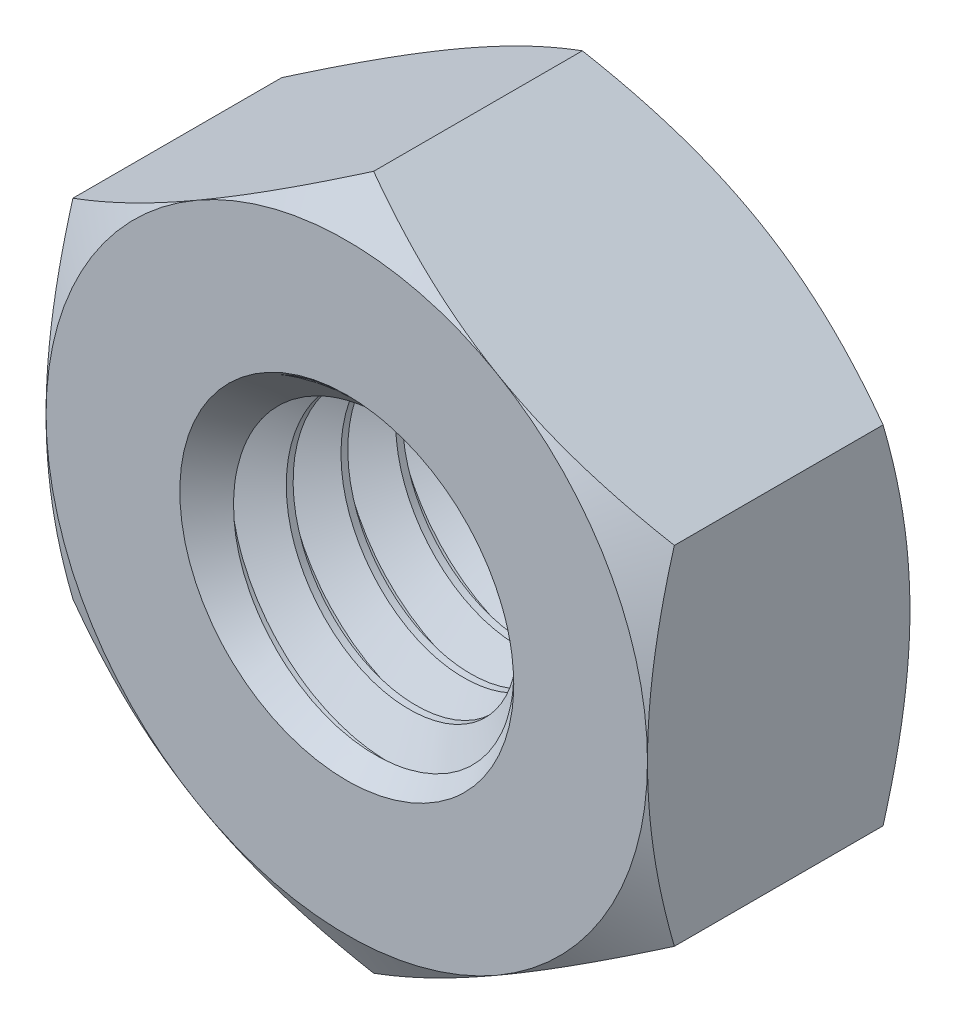
from build123d import *

# Parameters (mm, degrees)
BOSS_EXTRUDE1_DEPTH      = 1.2
BOSS_EXTRUDE1_DEPTH_BACK = 1.2
SKETCH2_R                = 1.5
SKETCH3_OUTSIDE_W        = 29.47
SKETCH3_OUTSIDE_H        = 30.32
SKETCH3_OUTSIDE_R        = 2.75
CUT_EXTRUDE1_DEPTH       = 5.837957558
CUT_EXTRUDE1_DRAFT       = -60
MIRROR1_COPY_1_SKETCH_W  = 29.47
MIRROR1_COPY_1_SKETCH_H  = 30.32
MIRROR1_COPY_1_SKETCH_R  = 2.75
MIRROR1_COPY_1_DEPTH     = 5.837957558
MIRROR1_COPY_1_DRAFT     = -60
SWEEP1_PITCH             = 0.5
SKETCH6_R                = 1.527063294
CUT_EXTRUDE2_DEPTH       = 6.113384751
SKETCH7_R                = 1.527063294
CUT_EXTRUDE3_DEPTH       = 5.837957664


with BuildPart() as part:
    # Sketch2 → Boss-Extrude1 (new, two sides: drawn at the far end of the back side and taken through both)
    with BuildSketch(Plane.XY.offset(-BOSS_EXTRUDE1_DEPTH_BACK)):
        Polygon((0, 3.175426481), (-2.75, 1.58771324), (-2.75, -1.58771324), (0, -3.175426481), (2.75, -1.58771324), (2.75, 1.58771324), align=None)
        Circle(SKETCH2_R, mode=Mode.SUBTRACT)
    extrude(amount=BOSS_EXTRUDE1_DEPTH + BOSS_EXTRUDE1_DEPTH_BACK)


with BuildPart() as cut_extrude1_tool:
    # Sketch3 outside → Cut-Extrude1 (with draft: the straight prism first)
    with BuildSketch(Plane.XY.offset(1.2)):
        Rectangle(SKETCH3_OUTSIDE_W, SKETCH3_OUTSIDE_H)
        Circle(SKETCH3_OUTSIDE_R, mode=Mode.SUBTRACT)
    extrude(amount=-CUT_EXTRUDE1_DEPTH)
    # Cut-Extrude1: the draft: its side faces are tilted about the plane it starts from
    cut_extrude1_sides = [cut_extrude1_tool.faces().sort_by_distance(p)[0] for p in [
        (0, -15.16, -1.718978779),
        (14.735, 0, -1.718978779),
        (0, 15.16, -1.718978779),
        (-14.735, 0, -1.718978779),
        (-2.75, 0, -1.718978779),
    ]]
    draft(cut_extrude1_sides, Plane.XY.offset(1.2), CUT_EXTRUDE1_DRAFT)


with BuildPart() as part_1:
    add(part.part)

    # Cut-Extrude1: cut by cut_extrude1_tool
    add(cut_extrude1_tool.part, mode=Mode.SUBTRACT)


with BuildPart() as mirror1_copy_1_tool:
    # Mirror1 copy 1 sketch → Mirror1 copy 1 (with draft: the straight prism first)
    with BuildSketch(Plane(origin=(0, 0, -1.2), x_dir=(1, 0, 0), z_dir=(0, 0, -1))):
        Rectangle(MIRROR1_COPY_1_SKETCH_W, MIRROR1_COPY_1_SKETCH_H)
        Circle(MIRROR1_COPY_1_SKETCH_R, mode=Mode.SUBTRACT)
    extrude(amount=-MIRROR1_COPY_1_DEPTH)
    # Mirror1 copy 1: the draft: its side faces are tilted about the plane it starts from
    mirror1_copy_1_sides = [mirror1_copy_1_tool.faces().sort_by_distance(p)[0] for p in [
        (0, -15.16, 1.718978779),
        (14.735, 0, 1.718978779),
        (0, 15.16, 1.718978779),
        (-14.735, 0, 1.718978779),
        (-2.75, 0, 1.718978779),
    ]]
    draft(mirror1_copy_1_sides, Plane(origin=(0, 0, -1.2), x_dir=(1, 0, 0), z_dir=(0, 0, -1)), MIRROR1_COPY_1_DRAFT)


with BuildPart() as part_2:
    add(part_1.part)

    # Mirror1 copy 1: cut by mirror1_copy_1_tool
    add(mirror1_copy_1_tool.part, mode=Mode.SUBTRACT)

    # Sweep1: the profile of Sketch4 screwed along a right-hand helix of 5.8 turns, 6 arcs to a turn; built about Z, then put on its axis
    sweep1_z = Axis((0, 0, 0), (0, 0, 1))
    sweep1_corners = [(1.527063294, 0, -0.453125), (1.175240474, 0, -0.25), (1.175240474, 0, -0.1875), (1.527063294, 0, 0.015625)]
    with BuildLine(mode=Mode.PRIVATE) as sweep1_profile:
        Line(sweep1_corners[0], sweep1_corners[1])
        Line(sweep1_corners[1], sweep1_corners[2])
        Line(sweep1_corners[2], sweep1_corners[3])
        Line(sweep1_corners[3], sweep1_corners[0])
    sweep1_cap = Face(sweep1_profile.wire())
    sweep1_turn_angles = [0, 30, 60, 90, 120, 150, 180, 210, 240, 270, 300, 330, 360]
    sweep1_turn_weights = [1, 0.8660254037844387, 1, 0.8660254037844387, 1, 0.8660254037844387, 1, 0.8660254037844387, 1, 0.8660254037844387, 1, 0.8660254037844387, 1]
    sweep1_turn_rails = [Edge.make_bspline([Vector(p[0], p[1], 0).rotate(sweep1_z, sweep1_turn_angles[k]) / sweep1_turn_weights[k] + Vector(0, 0, p[2] + SWEEP1_PITCH * sweep1_turn_angles[k] / 360) for k in range(13)], [0, 0, 0, 1, 1, 2, 2, 3, 3, 4, 4, 5, 5, 6, 6, 6], 2, sweep1_turn_weights) for p in sweep1_corners]
    sweep1_turn_sides = [Face.make_surface_from_curves(sweep1_turn_rails[p[0]], sweep1_turn_rails[p[1]]) for p in [(0, 1), (1, 2), (2, 3), (3, 0)]]
    sweep1_last_angles = [1800, 1830, 1860, 1890, 1920, 1950, 1980, 2010, 2040, 2064, 2088]
    sweep1_last_weights = [1, 0.8660254037844387, 1, 0.8660254037844387, 1, 0.8660254037844387, 1, 0.8660254037844387, 1, 0.9135454576426655, 1]
    sweep1_last_rails = [Edge.make_bspline([Vector(p[0], p[1], 0).rotate(sweep1_z, sweep1_last_angles[k]) / sweep1_last_weights[k] + Vector(0, 0, p[2] + SWEEP1_PITCH * sweep1_last_angles[k] / 360) for k in range(11)], [0, 0, 0, 1, 1, 2, 2, 3, 3, 4, 4, 5, 5, 5], 2, sweep1_last_weights) for p in sweep1_corners]
    sweep1_last_sides = [Face.make_surface_from_curves(sweep1_last_rails[p[0]], sweep1_last_rails[p[1]]) for p in [(0, 1), (1, 2), (2, 3), (3, 0)]]
    sweep1 = Plane(origin=(0, 0, 1.2), x_dir=(0, 1, 0), z_dir=(0, 0, -1)) * Solid(Shell([*[p.moved(Location((0, 0, SWEEP1_PITCH * i))) for i in range(5) for p in sweep1_turn_sides], *sweep1_last_sides, sweep1_cap, sweep1_cap.rotate(sweep1_z, 2088).moved(Location((0, 0, SWEEP1_PITCH * 2088 / 360)))]))
    add(sweep1)

    # Sketch6 → Cut-Extrude2 (cut)
    with BuildSketch(Plane.XY.offset(1.2)):
        Circle(SKETCH6_R)
    extrude(amount=CUT_EXTRUDE2_DEPTH, mode=Mode.SUBTRACT)

    # Cut-Extrude2 cone 1 section (through the dimple's axis) → Cut-Extrude2 other way (revolve, cut)
    with BuildSketch(Plane(origin=(0, 0, 1.2), x_dir=(0, -1, 0), z_dir=(1, 0, 0))):
        Polygon((0, 0), (1.527063294, 0), (0, 1.527063294), align=None)
    revolve(axis=Axis((0, 0, 1.2), (0, 0, -1)), mode=Mode.SUBTRACT)

    # Sketch7 → Cut-Extrude3 (cut)
    with BuildSketch(Plane(origin=(0, 0, -1.2), x_dir=(-1, 0, 0), z_dir=(0, 0, -1))):
        Circle(SKETCH7_R)
    extrude(amount=CUT_EXTRUDE3_DEPTH, mode=Mode.SUBTRACT)

    # Cut-Extrude3 cone 1 section (through the dimple's axis) → Cut-Extrude3 other way (revolve, cut)
    with BuildSketch(Plane(origin=(0, 0, -1.2), x_dir=(0, 1, 0), z_dir=(1, 0, 0))):
        Polygon((0, 0), (1.527063294, 0), (0, 1.527063294), align=None)
    revolve(axis=Axis((0, 0, -1.2), (0, 0, 1)), mode=Mode.SUBTRACT)


solid = part_2.part
